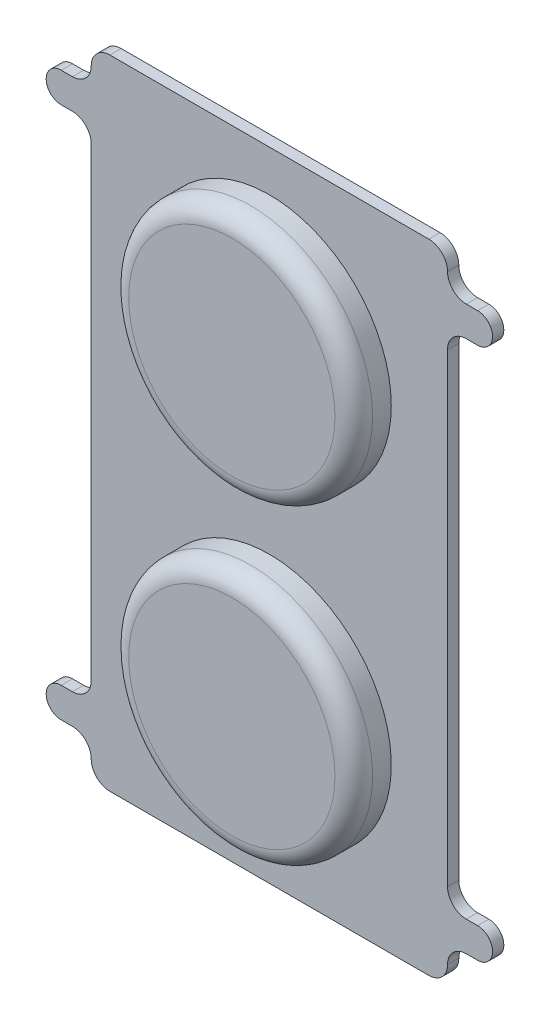
from build123d import *

# Parameters (mm, degrees)
EXTRUDE_1_DEPTH = 3
FILLET_1_R      = 5
SKETCH_2_R      = 32.5
EXTRUDE_2_DEPTH = 10
FILLET_2_R      = 5


with BuildPart() as part:
    # 草圖1 → 填料-伸長1 (new body)
    with BuildSketch(Plane.XY):
        with BuildLine():
            Line((-47.5, 67), (-47.5, -67))
            Line((-47.5, -67), (-55.5, -67))
            ThreePointArc((-55.5, -67), (-59.5, -71), (-55.5, -75))
            Line((-55.5, -75), (-47.5, -75))
            Line((-47.5, -75), (-47.5, -85))
            Line((-47.5, -85), (47.5, -85))
            Line((47.5, -85), (47.5, -75))
            Line((47.5, -75), (55.5, -75))
            ThreePointArc((55.5, -75), (59.5, -71), (55.5, -67))
            Line((55.5, -67), (47.5, -67))
            Line((47.5, -67), (47.5, 67))
            Line((47.5, 67), (55.5, 67))
            ThreePointArc((55.5, 67), (59.5, 71), (55.5, 75))
            Line((55.5, 75), (47.5, 75))
            Line((47.5, 75), (47.5, 85))
            Line((47.5, 85), (-47.5, 85))
            Line((-47.5, 85), (-47.5, 75))
            Line((-47.5, 75), (-55.5, 75))
            ThreePointArc((-55.5, 75), (-59.5, 71), (-55.5, 67))
            Line((-55.5, 67), (-47.5, 67))
        make_face()
    extrude(amount=EXTRUDE_1_DEPTH)

    # 圓角1
    fillet_1_edges = [part.edges().sort_by_distance(p)[0] for p in [
        (-47.5, 85, 1.5),
        (47.5, 85, 1.5),
        (47.5, 75, 1.5),
        (47.5, 67, 1.5),
        (47.5, -67, 1.5),
        (47.5, -75, 1.5),
        (47.5, -85, 1.5),
        (-47.5, -85, 1.5),
        (-47.5, -75, 1.5),
        (-47.5, -67, 1.5),
        (-47.5, 67, 1.5),
        (-47.5, 75, 1.5),
    ]]
    fillet(fillet_1_edges, radius=FILLET_1_R - 0.0001)  # a hair under: the kernel refuses the full size

    # 草圖2 → 填料-伸長2 (add)
    with BuildSketch(Plane.XY.offset(3)):
        with Locations((0, 41.5)):
            Circle(SKETCH_2_R)
        with Locations(Location((0, -41.5, 0), (0, 0, 180))):
            Circle(SKETCH_2_R)
    extrude(amount=EXTRUDE_2_DEPTH)

    # 圓角2
    fillet_2_edges = [part.edges().sort_by_distance(p)[0] for p in [
        (-32.5, 41.5, 13),
        (32.5, -41.5, 13),
    ]]
    fillet(fillet_2_edges, radius=FILLET_2_R)


solid = part.part
